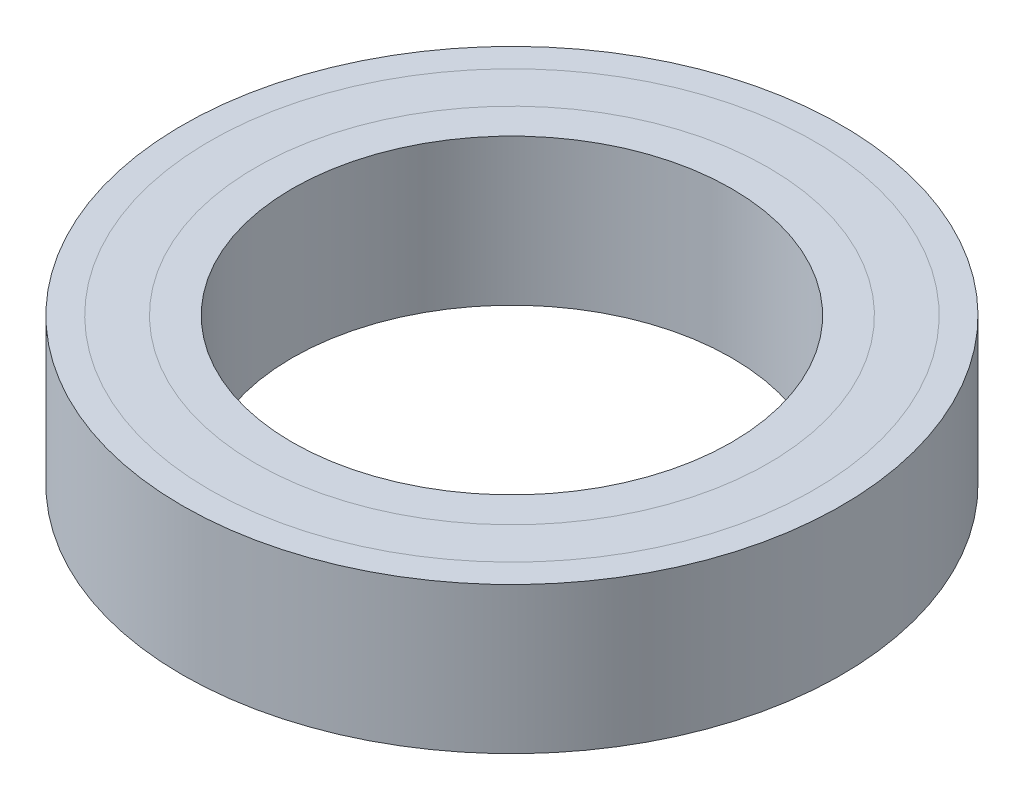
from build123d import *

# Parameters (mm, degrees)
SKETCH_1_R                   = 9
SKETCH_1_R_2                 = 6
EXTRUDE_1_DEPTH              = 4
SPLIT_BODIES_1_OUTLINE_R     = 8.25
SPLIT_BODIES_1_OUTLINE_R_2   = 7
SPLIT_BODIES_1_DEPTH         = 4
SPLIT_BODIES_1_2_OUTLINE_R   = 9
SPLIT_BODIES_1_2_OUTLINE_R_2 = 7
SPLIT_BODIES_1_2_DEPTH       = 4
SPLIT_BODIES_1_3_OUTLINE_R   = 9
SPLIT_BODIES_1_3_OUTLINE_R_2 = 8.25
SPLIT_BODIES_1_3_DEPTH       = 4


# Read off the part's stored shape, not the designer's step: 分割1
with BuildPart() as part:
    # 草图1 → 凸台-拉伸1 (new body)
    with BuildSketch(Plane(origin=(0, 0, 0), x_dir=(1, 0, 0), z_dir=(0, 1, 0))):
        with Locations(Location((0, 0, 0), (0, 0, 270))):
            Circle(SKETCH_1_R)
        with Locations(Location((0, 0, 0), (0, 0, 270))):
            Circle(SKETCH_1_R_2, mode=Mode.SUBTRACT)
    extrude(amount=EXTRUDE_1_DEPTH)

    # Split Bodies 1 2 outline → Split Bodies 1 2 (cut)
    with BuildSketch(Plane(origin=(0, 0, 0), x_dir=(1, 0, 0), z_dir=(0, 1, 0))):
        Circle(SPLIT_BODIES_1_2_OUTLINE_R)
        Circle(SPLIT_BODIES_1_2_OUTLINE_R_2, mode=Mode.SUBTRACT)
    extrude(amount=SPLIT_BODIES_1_2_DEPTH, mode=Mode.SUBTRACT)


with BuildPart() as body_2:
    # Split Bodies 1 outline → Split Bodies 1 (new body)
    with BuildSketch(Plane(origin=(0, 0, 0), x_dir=(1, 0, 0), z_dir=(0, 1, 0))):
        Circle(SPLIT_BODIES_1_OUTLINE_R)
        Circle(SPLIT_BODIES_1_OUTLINE_R_2, mode=Mode.SUBTRACT)
    extrude(amount=SPLIT_BODIES_1_DEPTH)


with BuildPart() as body_3:
    # Split Bodies 1 3 outline → Split Bodies 1 3 (new body)
    with BuildSketch(Plane(origin=(0, 0, 0), x_dir=(1, 0, 0), z_dir=(0, 1, 0))):
        Circle(SPLIT_BODIES_1_3_OUTLINE_R)
        Circle(SPLIT_BODIES_1_3_OUTLINE_R_2, mode=Mode.SUBTRACT)
    extrude(amount=SPLIT_BODIES_1_3_DEPTH)


solid = Compound([part.part, body_2.part, body_3.part])
